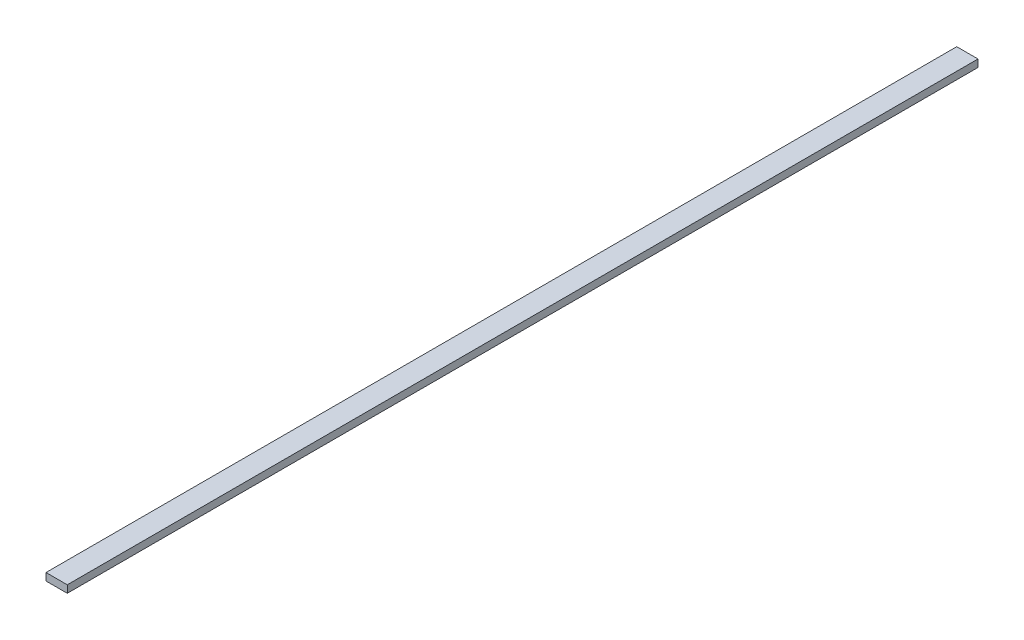
from build123d import *

# Parameters (mm, degrees)
SKETCH1_W           = 21.6
SKETCH1_H           = 7.5
BOSS_EXTRUDE1_DEPTH = 925


with BuildPart() as part:
    # Sketch1 → Boss-Extrude1 (new body)
    with BuildSketch(Plane.XY):
        with Locations((10.8, 3.75)):
            Rectangle(SKETCH1_W, SKETCH1_H)
    extrude(amount=BOSS_EXTRUDE1_DEPTH)


solid = part.part
